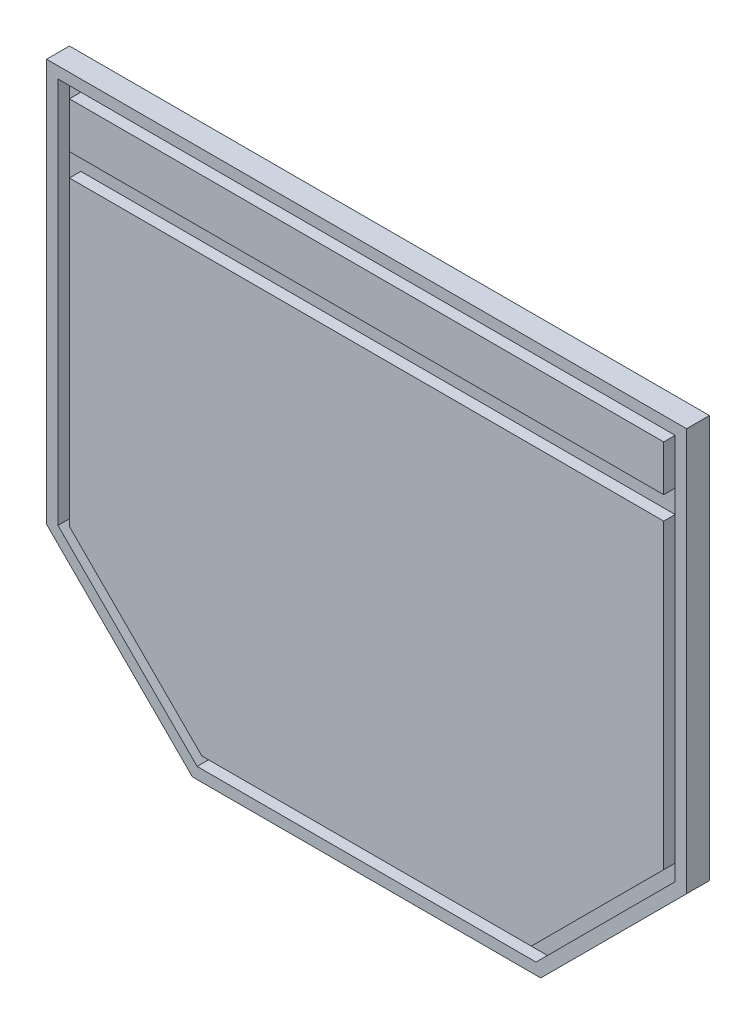
from build123d import *

# Parameters (mm, degrees)
BOSS_EXTRUDE1_DEPTH = 12.7
SKETCH2_W           = 330.2
SKETCH2_H           = 25.4
CUT_EXTRUDE1_DEPTH  = 6.35


with BuildPart() as part:
    # Sketch1 → Boss-Extrude1 (new body)
    with BuildSketch(Plane.XY):
        Polygon((0, 0), (355.6, 0), (355.6, -223.774), (292.534512242, -286.839487758), (274.574, -304.8), (81.026, -304.8), (63.065487758, -286.839487758), (0, -223.774), align=None)
    extrude(amount=BOSS_EXTRUDE1_DEPTH)

    # Sketch2 → Cut-Extrude1 (cut)
    with BuildSketch(Plane.XY.offset(12.7)):
        Polygon((6.35, -221.143743879), (83.656256121, -298.45), (271.943743879, -298.45), (349.25, -221.143743879), (349.25, -6.35), (6.35, -6.35), align=None)
        with Locations((177.8, -25.4)):
            Rectangle(SKETCH2_W, SKETCH2_H, mode=Mode.SUBTRACT)
        Polygon((12.7, -218.513487758), (86.286512242, -292.1), (269.313487758, -292.1), (342.9, -218.513487758), (342.9, -50.8), (12.7, -50.8), align=None, mode=Mode.SUBTRACT)
    extrude(amount=-CUT_EXTRUDE1_DEPTH, mode=Mode.SUBTRACT)


solid = part.part
